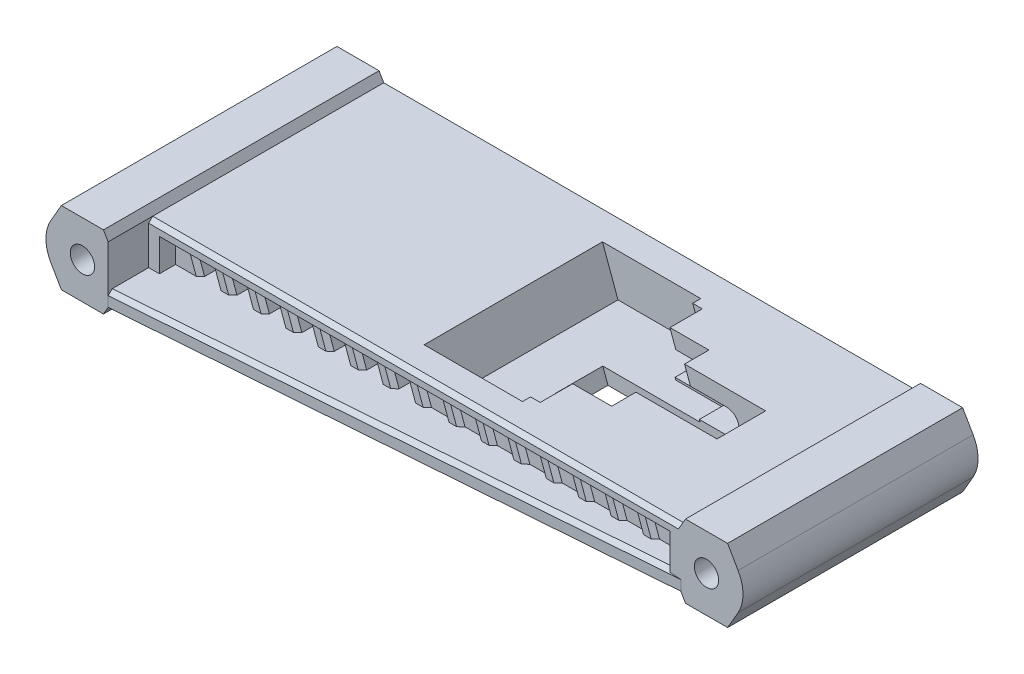
from build123d import *

# Parameters (mm, degrees)
SKETCH2_R           = 1.5
BOSS_EXTRUDE1_DEPTH = 2.5
SKETCH3_R           = 1.5
BOSS_EXTRUDE2_DEPTH = 24
SKETCH6_R           = 1.5
BOSS_EXTRUDE3_DEPTH = 0.5
SKETCH7_R           = 1.5
SKETCH7_W           = 63
SKETCH7_H           = 3.5
BOSS_EXTRUDE4_DEPTH = 7
CUT_EXTRUDE1_DEPTH  = 5
CUT_EXTRUDE2_DEPTH  = 5.25
CHAMFER1_SIZE       = 0.5
CUT_EXTRUDE3_DEPTH  = 3
CUT_EXTRUDE4_DEPTH  = 6
CUT_EXTRUDE5_DEPTH  = 11
CUT_EXTRUDE6_DEPTH  = 10


with BuildPart() as part:
    # Sketch2 → Boss-Extrude1 (new body)
    with BuildSketch(Plane.XY):
        with BuildLine():
            Line((32.824573519, -3.5), (-32.824573519, -3.5))
            Line((-32.824573519, -3.5), (-33.401923789, -4.5))
            Line((-33.401923789, -4.5), (-38.598076211, -4.5))
            Line((-38.598076211, -4.5), (-39.897114317, -2.25))
            ThreePointArc((-39.897114317, -2.25), (-40.5, 0), (-39.897114317, 2.25))
            Line((-39.897114317, 2.25), (-38.598076211, 4.5))
            Line((-38.598076211, 4.5), (-33.401923789, 4.5))
            Line((-33.401923789, 4.5), (-32.824573519, 3.5))
            Line((-32.824573519, 3.5), (32.824573519, 3.5))
            Line((32.824573519, 3.5), (33.401923789, 4.5))
            Line((33.401923789, 4.5), (38.598076211, 4.5))
            Line((38.598076211, 4.5), (39.897114317, 2.25))
            ThreePointArc((39.897114317, 2.25), (40.5, 0), (39.897114317, -2.25))
            Line((39.897114317, -2.25), (38.598076211, -4.5))
            Line((38.598076211, -4.5), (33.401923789, -4.5))
            Line((33.401923789, -4.5), (32.824573519, -3.5))
        make_face()
        with Locations((-36, 0)):
            Circle(SKETCH2_R, mode=Mode.SUBTRACT)
        with Locations((36, 0)):
            Circle(SKETCH2_R, mode=Mode.SUBTRACT)
        Polygon((-27.701125682, 1.75), (-26.427229863, -1.75), (-28.427229863, -1.75), (-29.701125682, 1.75), align=None, mode=Mode.SUBTRACT)
        Polygon((-25.701125682, 1.75), (-24.427229863, -1.75), (-22.427229863, -1.75), (-23.701125682, 1.75), align=None, mode=Mode.SUBTRACT)
        Polygon((-21.701125682, 1.75), (-20.427229863, -1.75), (-18.427229863, -1.75), (-19.701125682, 1.75), align=None, mode=Mode.SUBTRACT)
        Polygon((-17.701125682, 1.75), (-16.427229863, -1.75), (-14.427229863, -1.75), (-15.701125682, 1.75), align=None, mode=Mode.SUBTRACT)
        Polygon((-13.701125682, 1.75), (-12.427229863, -1.75), (-10.427229863, -1.75), (-11.701125682, 1.75), align=None, mode=Mode.SUBTRACT)
        Polygon((-9.701125682, 1.75), (-8.427229863, -1.75), (-6.427229863, -1.75), (-7.701125682, 1.75), align=None, mode=Mode.SUBTRACT)
        Polygon((-5.701125682, 1.75), (-4.427229863, -1.75), (-2.427229863, -1.75), (-3.701125682, 1.75), align=None, mode=Mode.SUBTRACT)
        Polygon((-1.701125682, 1.75), (-0.427229863, -1.75), (1.701125682, -1.75), (0.427229863, 1.75), align=None, mode=Mode.SUBTRACT)
        Polygon((2.427229863, 1.75), (3.701125682, -1.75), (5.701125682, -1.75), (4.427229863, 1.75), align=None, mode=Mode.SUBTRACT)
        Polygon((6.427229863, 1.75), (7.701125682, -1.75), (9.701125682, -1.75), (8.427229863, 1.75), align=None, mode=Mode.SUBTRACT)
        Polygon((10.427229863, 1.75), (11.701125682, -1.75), (13.701125682, -1.75), (12.427229863, 1.75), align=None, mode=Mode.SUBTRACT)
        Polygon((14.427229863, 1.75), (15.701125682, -1.75), (17.701125682, -1.75), (16.427229863, 1.75), align=None, mode=Mode.SUBTRACT)
        Polygon((18.427229863, 1.75), (19.701125682, -1.75), (21.701125682, -1.75), (20.427229863, 1.75), align=None, mode=Mode.SUBTRACT)
        Polygon((22.427229863, 1.75), (23.701125682, -1.75), (25.701125682, -1.75), (24.427229863, 1.75), align=None, mode=Mode.SUBTRACT)
        Polygon((26.427229863, 1.75), (27.701125682, -1.75), (29.701125682, -1.75), (28.427229863, 1.75), align=None, mode=Mode.SUBTRACT)
    extrude(amount=BOSS_EXTRUDE1_DEPTH)

    # Sketch3 → Boss-Extrude2 (add)
    with BuildSketch(Plane.XY.offset(2.5)):
        with BuildLine():
            Line((-39.897114317, -2.25), (-38.598076211, -4.5))
            Line((-38.598076211, -4.5), (-33.401923789, -4.5))
            Line((-33.401923789, -4.5), (-32.824573519, -3.5))
            Line((-32.824573519, -3.5), (32.824573519, -3.5))
            Line((32.824573519, -3.5), (33.401923789, -4.5))
            Line((33.401923789, -4.5), (38.598076211, -4.5))
            Line((38.598076211, -4.5), (39.897114317, -2.25))
            ThreePointArc((39.897114317, -2.25), (40.5, 0), (39.897114317, 2.25))
            Line((39.897114317, 2.25), (38.598076211, 4.5))
            Line((38.598076211, 4.5), (33.401923789, 4.5))
            Line((33.401923789, 4.5), (32.824573519, 3.5))
            Line((32.824573519, 3.5), (-32.824573519, 3.5))
            Line((-32.824573519, 3.5), (-33.401923789, 4.5))
            Line((-33.401923789, 4.5), (-38.598076211, 4.5))
            Line((-38.598076211, 4.5), (-39.897114317, 2.25))
            ThreePointArc((-39.897114317, 2.25), (-40.5, 0), (-39.897114317, -2.25))
        make_face()
        with Locations((-36, 0)):
            Circle(SKETCH3_R, mode=Mode.SUBTRACT)
        with Locations((36, 0)):
            Circle(SKETCH3_R, mode=Mode.SUBTRACT)
        Polygon((-27.701125682, 1.75), (-29.701125682, 1.75), (-28.427229863, -1.75), (-26.427229863, -1.75), align=None, mode=Mode.SUBTRACT)
        Polygon((-25.701125682, 1.75), (-24.427229863, -1.75), (-22.427229863, -1.75), (-23.701125682, 1.75), align=None, mode=Mode.SUBTRACT)
        Polygon((-21.701125682, 1.75), (-20.427229863, -1.75), (-18.427229863, -1.75), (-19.701125682, 1.75), align=None, mode=Mode.SUBTRACT)
        Polygon((-17.701125682, 1.75), (-16.427229863, -1.75), (-14.427229863, -1.75), (-15.701125682, 1.75), align=None, mode=Mode.SUBTRACT)
        Polygon((-13.701125682, 1.75), (-12.427229863, -1.75), (-10.427229863, -1.75), (-11.701125682, 1.75), align=None, mode=Mode.SUBTRACT)
        Polygon((-9.701125682, 1.75), (-8.427229863, -1.75), (-6.427229863, -1.75), (-7.701125682, 1.75), align=None, mode=Mode.SUBTRACT)
        Polygon((-5.701125682, 1.75), (-4.427229863, -1.75), (-2.427229863, -1.75), (-3.701125682, 1.75), align=None, mode=Mode.SUBTRACT)
    extrude(amount=BOSS_EXTRUDE2_DEPTH)

    # Sketch6 → Boss-Extrude3 (add)
    with BuildSketch(Plane.XY.offset(26.5)):
        with BuildLine():
            Line((-38.598076211, 4.5), (-39.897114317, 2.25))
            ThreePointArc((-39.897114317, 2.25), (-40.5, 0), (-39.897114317, -2.25))
            Line((-39.897114317, -2.25), (-38.598076211, -4.5))
            Line((-38.598076211, -4.5), (-33.401923789, -4.5))
            Line((-33.401923789, -4.5), (-32.824573519, -3.5))
            Line((-32.824573519, -3.5), (32.824573519, -3.5))
            Line((32.824573519, -3.5), (33.401923789, -4.5))
            Line((33.401923789, -4.5), (38.598076211, -4.5))
            Line((38.598076211, -4.5), (39.897114317, -2.25))
            ThreePointArc((39.897114317, -2.25), (40.5, 0), (39.897114317, 2.25))
            Line((39.897114317, 2.25), (38.598076211, 4.5))
            Line((38.598076211, 4.5), (33.401923789, 4.5))
            Line((33.401923789, 4.5), (32.824573519, 3.5))
            Line((32.824573519, 3.5), (-32.824573519, 3.5))
            Line((-32.824573519, 3.5), (-33.401923789, 4.5))
            Line((-33.401923789, 4.5), (-38.598076211, 4.5))
        make_face()
        with Locations((-36, 0)):
            Circle(SKETCH6_R, mode=Mode.SUBTRACT)
        with Locations((36, 0)):
            Circle(SKETCH6_R, mode=Mode.SUBTRACT)
        Polygon((-28.427229863, -1.75), (-26.427229863, -1.75), (-27.701125682, 1.75), (-29.701125682, 1.75), align=None, mode=Mode.SUBTRACT)
        Polygon((28.427229863, 1.75), (26.427229863, 1.75), (27.701125682, -1.75), (29.701125682, -1.75), align=None, mode=Mode.SUBTRACT)
        Polygon((-25.701125682, 1.75), (-24.427229863, -1.75), (-22.427229863, -1.75), (-23.701125682, 1.75), align=None, mode=Mode.SUBTRACT)
        Polygon((-21.701125682, 1.75), (-20.427229863, -1.75), (-18.427229863, -1.75), (-19.701125682, 1.75), align=None, mode=Mode.SUBTRACT)
        Polygon((-17.701125682, 1.75), (-16.427229863, -1.75), (-14.427229863, -1.75), (-15.701125682, 1.75), align=None, mode=Mode.SUBTRACT)
        Polygon((-13.701125682, 1.75), (-12.427229863, -1.75), (-10.427229863, -1.75), (-11.701125682, 1.75), align=None, mode=Mode.SUBTRACT)
        Polygon((-9.701125682, 1.75), (-8.427229863, -1.75), (-6.427229863, -1.75), (-7.701125682, 1.75), align=None, mode=Mode.SUBTRACT)
        Polygon((-5.701125682, 1.75), (-4.427229863, -1.75), (-2.427229863, -1.75), (-3.701125682, 1.75), align=None, mode=Mode.SUBTRACT)
        Polygon((-1.701125682, 1.75), (-0.427229863, -1.75), (1.701125682, -1.75), (0.427229863, 1.75), align=None, mode=Mode.SUBTRACT)
        Polygon((2.427229863, 1.75), (3.701125682, -1.75), (5.701125682, -1.75), (4.427229863, 1.75), align=None, mode=Mode.SUBTRACT)
        Polygon((6.427229863, 1.75), (7.701125682, -1.75), (9.701125682, -1.75), (8.427229863, 1.75), align=None, mode=Mode.SUBTRACT)
        Polygon((10.427229863, 1.75), (11.701125682, -1.75), (13.701125682, -1.75), (12.427229863, 1.75), align=None, mode=Mode.SUBTRACT)
        Polygon((14.427229863, 1.75), (15.701125682, -1.75), (17.701125682, -1.75), (16.427229863, 1.75), align=None, mode=Mode.SUBTRACT)
        Polygon((18.427229863, 1.75), (19.701125682, -1.75), (21.701125682, -1.75), (20.427229863, 1.75), align=None, mode=Mode.SUBTRACT)
        Polygon((22.427229863, 1.75), (23.701125682, -1.75), (25.701125682, -1.75), (24.427229863, 1.75), align=None, mode=Mode.SUBTRACT)
    extrude(amount=BOSS_EXTRUDE3_DEPTH)

    # Sketch7 → Boss-Extrude4 (add)
    with BuildSketch(Plane.XY.offset(27)):
        with BuildLine():
            Line((-33.401923789, 4.5), (-38.598076211, 4.5))
            Line((-38.598076211, 4.5), (-39.897114317, 2.25))
            ThreePointArc((-39.897114317, 2.25), (-40.5, 0), (-39.897114317, -2.25))
            Line((-39.897114317, -2.25), (-38.598076211, -4.5))
            Line((-38.598076211, -4.5), (-33.401923789, -4.5))
            Line((-33.401923789, -4.5), (-32.824573519, -3.5))
            Line((-32.824573519, -3.5), (32.824573519, -3.5))
            Line((32.824573519, -3.5), (33.401923789, -4.5))
            Line((33.401923789, -4.5), (38.598076211, -4.5))
            Line((38.598076211, -4.5), (39.897114317, -2.25))
            ThreePointArc((39.897114317, -2.25), (40.5, 0), (39.897114317, 2.25))
            Line((39.897114317, 2.25), (38.598076211, 4.5))
            Line((38.598076211, 4.5), (33.401923789, 4.5))
            Line((33.401923789, 4.5), (32.824573519, 3.5))
            Line((32.824573519, 3.5), (-32.824573519, 3.5))
            Line((-32.824573519, 3.5), (-33.401923789, 4.5))
        make_face()
        with Locations((-36, 0)):
            Circle(SKETCH7_R, mode=Mode.SUBTRACT)
        with Locations((36, 0)):
            Circle(SKETCH7_R, mode=Mode.SUBTRACT)
        Rectangle(SKETCH7_W, SKETCH7_H, mode=Mode.SUBTRACT)
    extrude(amount=BOSS_EXTRUDE4_DEPTH)

    # Sketch8 → Cut-Extrude1 (cut, symmetric)
    with BuildSketch(Plane(origin=(0, 0, 0), x_dir=(1, 0, 0), z_dir=(0, 1, 0))):
        Polygon((40.5, -34), (-32.824573519, -34), (32.824573519, -29), (40.5, -29), align=None)
    extrude(amount=CUT_EXTRUDE1_DEPTH, both=True, mode=Mode.SUBTRACT)

    # Sketch9 → Cut-Extrude2 (cut)
    with BuildSketch(Plane(origin=(0, 3.5, 0), x_dir=(1, 0, 0), z_dir=(0, 1, 0))):
        Polygon((32.824573519, -29), (-32.824573519, -29), (-32.824573519, -34), align=None)
    extrude(amount=-CUT_EXTRUDE2_DEPTH, mode=Mode.SUBTRACT)

    # Chamfer1
    # the kernel refuses this chamfer: 0.5 mm, written as the material it takes off along each edge
    with BuildSketch(Plane(origin=(18.140909375, -2.958295763, 27), x_dir=(0.9393373388974084, 0.3418908312934854, 0.0274958766105891), z_dir=(-0.34202014332567277, 0.939692620785907, 0))) as chamfer1_piece_1_section:
        Polygon((CHAMFER1_SIZE * 0.999621916911, CHAMFER1_SIZE * 0.0274958766106), (-CHAMFER1_SIZE * 0.0274958766106, CHAMFER1_SIZE * 0.999621916911), (0, 0), align=None)
    chamfer1_piece_1 = extrude(amount=6.296305192, mode=Mode.PRIVATE)
    chamfer1_piece_1 = split(chamfer1_piece_1, bisect_by=Plane(origin=(17.239982151, -1.75, 26.835682833), z_dir=(0, 1, 0)), keep=Keep.TOP, mode=Mode.PRIVATE)
    chamfer1_piece_1 = split(chamfer1_piece_1, bisect_by=Plane(origin=(17.239982151, 1.75, 26.835682833), z_dir=(0, -1, 0)), keep=Keep.TOP, mode=Mode.PRIVATE)
    chamfer1_piece_1 = split(chamfer1_piece_1, bisect_by=Plane(origin=(17.239982151, 0, 26.5), z_dir=(0, 0, 1)), keep=Keep.TOP, mode=Mode.PRIVATE)
    add(chamfer1_piece_1, mode=Mode.SUBTRACT)
    with BuildSketch(Plane(origin=(17.98744617, 2.958295763, 27), x_dir=(0.025837672353008382, 0.009404143659217963, -0.9996219169112968), z_dir=(0.34202014332567277, -0.939692620785907, 0))) as chamfer1_piece_2_section:
        Polygon((CHAMFER1_SIZE * 0.999621916911, -CHAMFER1_SIZE * 0.0274958766106), (-CHAMFER1_SIZE * 0.0274958766106, -CHAMFER1_SIZE * 0.999621916911), (0, 0), align=None)
    chamfer1_piece_2 = extrude(amount=6.296305192, mode=Mode.PRIVATE)
    chamfer1_piece_2 = split(chamfer1_piece_2, bisect_by=Plane(origin=(18.888373394, -1.75, 26.835682833), z_dir=(0, 1, 0)), keep=Keep.TOP, mode=Mode.PRIVATE)
    chamfer1_piece_2 = split(chamfer1_piece_2, bisect_by=Plane(origin=(18.888373394, 1.75, 26.835682833), z_dir=(0, -1, 0)), keep=Keep.TOP, mode=Mode.PRIVATE)
    chamfer1_piece_2 = split(chamfer1_piece_2, bisect_by=Plane(origin=(18.888373394, 0, 26.5), z_dir=(0, 0, 1)), keep=Keep.TOP, mode=Mode.PRIVATE)
    add(chamfer1_piece_2, mode=Mode.SUBTRACT)
    with BuildSketch(Plane(origin=(22.140909375, -2.958295763, 27), x_dir=(0.9393373388974084, 0.3418908312934854, 0.0274958766105891), z_dir=(-0.34202014332567277, 0.939692620785907, 0))) as chamfer1_piece_3_section:
        Polygon((CHAMFER1_SIZE * 0.999621916911, CHAMFER1_SIZE * 0.0274958766106), (-CHAMFER1_SIZE * 0.0274958766106, CHAMFER1_SIZE * 0.999621916911), (0, 0), align=None)
    chamfer1_piece_3 = extrude(amount=6.296305192, mode=Mode.PRIVATE)
    chamfer1_piece_3 = split(chamfer1_piece_3, bisect_by=Plane(origin=(21.239982151, -1.75, 26.835682833), z_dir=(0, 1, 0)), keep=Keep.TOP, mode=Mode.PRIVATE)
    chamfer1_piece_3 = split(chamfer1_piece_3, bisect_by=Plane(origin=(21.239982151, 1.75, 26.835682833), z_dir=(0, -1, 0)), keep=Keep.TOP, mode=Mode.PRIVATE)
    chamfer1_piece_3 = split(chamfer1_piece_3, bisect_by=Plane(origin=(21.239982151, 0, 26.5), z_dir=(0, 0, 1)), keep=Keep.TOP, mode=Mode.PRIVATE)
    add(chamfer1_piece_3, mode=Mode.SUBTRACT)
    with BuildSketch(Plane(origin=(21.98744617, 2.958295763, 27), x_dir=(0.025837672353009215, 0.009404143659218267, -0.9996219169112968), z_dir=(0.34202014332567277, -0.939692620785907, 0))) as chamfer1_piece_4_section:
        Polygon((CHAMFER1_SIZE * 0.999621916911, -CHAMFER1_SIZE * 0.0274958766106), (-CHAMFER1_SIZE * 0.0274958766106, -CHAMFER1_SIZE * 0.999621916911), (0, 0), align=None)
    chamfer1_piece_4 = extrude(amount=6.296305192, mode=Mode.PRIVATE)
    chamfer1_piece_4 = split(chamfer1_piece_4, bisect_by=Plane(origin=(22.888373394, -1.75, 26.835682833), z_dir=(0, 1, 0)), keep=Keep.TOP, mode=Mode.PRIVATE)
    chamfer1_piece_4 = split(chamfer1_piece_4, bisect_by=Plane(origin=(22.888373394, 1.75, 26.835682833), z_dir=(0, -1, 0)), keep=Keep.TOP, mode=Mode.PRIVATE)
    chamfer1_piece_4 = split(chamfer1_piece_4, bisect_by=Plane(origin=(22.888373394, 0, 26.5), z_dir=(0, 0, 1)), keep=Keep.TOP, mode=Mode.PRIVATE)
    add(chamfer1_piece_4, mode=Mode.SUBTRACT)
    with BuildSketch(Plane(origin=(26.140909375, -2.958295763, 27), x_dir=(0.9393373388974084, 0.3418908312934854, 0.0274958766105891), z_dir=(-0.34202014332567277, 0.939692620785907, 0))) as chamfer1_piece_5_section:
        Polygon((CHAMFER1_SIZE * 0.999621916911, CHAMFER1_SIZE * 0.0274958766106), (-CHAMFER1_SIZE * 0.0274958766106, CHAMFER1_SIZE * 0.999621916911), (0, 0), align=None)
    chamfer1_piece_5 = extrude(amount=6.296305192, mode=Mode.PRIVATE)
    chamfer1_piece_5 = split(chamfer1_piece_5, bisect_by=Plane(origin=(25.239982151, -1.75, 26.835682833), z_dir=(0, 1, 0)), keep=Keep.TOP, mode=Mode.PRIVATE)
    chamfer1_piece_5 = split(chamfer1_piece_5, bisect_by=Plane(origin=(25.239982151, 1.75, 26.835682833), z_dir=(0, -1, 0)), keep=Keep.TOP, mode=Mode.PRIVATE)
    chamfer1_piece_5 = split(chamfer1_piece_5, bisect_by=Plane(origin=(25.239982151, 0, 26.5), z_dir=(0, 0, 1)), keep=Keep.TOP, mode=Mode.PRIVATE)
    add(chamfer1_piece_5, mode=Mode.SUBTRACT)
    with BuildSketch(Plane(origin=(25.98744617, 2.958295763, 27), x_dir=(0.025837672353009766, 0.00940414365921847, -0.9996219169112968), z_dir=(0.34202014332567277, -0.939692620785907, 0))) as chamfer1_piece_6_section:
        Polygon((CHAMFER1_SIZE * 0.999621916911, -CHAMFER1_SIZE * 0.0274958766106), (-CHAMFER1_SIZE * 0.0274958766106, -CHAMFER1_SIZE * 0.999621916911), (0, 0), align=None)
    chamfer1_piece_6 = extrude(amount=6.296305192, mode=Mode.PRIVATE)
    chamfer1_piece_6 = split(chamfer1_piece_6, bisect_by=Plane(origin=(26.888373394, -1.75, 26.835682833), z_dir=(0, 1, 0)), keep=Keep.TOP, mode=Mode.PRIVATE)
    chamfer1_piece_6 = split(chamfer1_piece_6, bisect_by=Plane(origin=(26.888373394, 1.75, 26.835682833), z_dir=(0, -1, 0)), keep=Keep.TOP, mode=Mode.PRIVATE)
    chamfer1_piece_6 = split(chamfer1_piece_6, bisect_by=Plane(origin=(26.888373394, 0, 26.5), z_dir=(0, 0, 1)), keep=Keep.TOP, mode=Mode.PRIVATE)
    add(chamfer1_piece_6, mode=Mode.SUBTRACT)
    with BuildSketch(Plane(origin=(30.140909375, -2.958295763, 27), x_dir=(0.9393373388974084, 0.3418908312934854, 0.0274958766105891), z_dir=(-0.34202014332567277, 0.939692620785907, 0))) as chamfer1_piece_7_section:
        Polygon((CHAMFER1_SIZE * 0.999621916911, CHAMFER1_SIZE * 0.0274958766106), (-CHAMFER1_SIZE * 0.0274958766106, CHAMFER1_SIZE * 0.999621916911), (0, 0), align=None)
    chamfer1_piece_7 = extrude(amount=6.296305192, mode=Mode.PRIVATE)
    chamfer1_piece_7 = split(chamfer1_piece_7, bisect_by=Plane(origin=(29.239982151, -1.75, 26.835682833), z_dir=(0, 1, 0)), keep=Keep.TOP, mode=Mode.PRIVATE)
    chamfer1_piece_7 = split(chamfer1_piece_7, bisect_by=Plane(origin=(29.239982151, 1.75, 26.835682833), z_dir=(0, -1, 0)), keep=Keep.TOP, mode=Mode.PRIVATE)
    chamfer1_piece_7 = split(chamfer1_piece_7, bisect_by=Plane(origin=(29.239982151, 0, 26.5), z_dir=(0, 0, 1)), keep=Keep.TOP, mode=Mode.PRIVATE)
    add(chamfer1_piece_7, mode=Mode.SUBTRACT)
    with BuildSketch(Plane(origin=(13.98744617, 2.958295763, 27), x_dir=(0.025837672353008937, 0.009404143659218166, -0.9996219169112968), z_dir=(0.34202014332567277, -0.939692620785907, 0))) as chamfer1_piece_8_section:
        Polygon((CHAMFER1_SIZE * 0.999621916911, -CHAMFER1_SIZE * 0.0274958766106), (-CHAMFER1_SIZE * 0.0274958766106, -CHAMFER1_SIZE * 0.999621916911), (0, 0), align=None)
    chamfer1_piece_8 = extrude(amount=6.296305192, mode=Mode.PRIVATE)
    chamfer1_piece_8 = split(chamfer1_piece_8, bisect_by=Plane(origin=(14.888373394, -1.75, 26.835682833), z_dir=(0, 1, 0)), keep=Keep.TOP, mode=Mode.PRIVATE)
    chamfer1_piece_8 = split(chamfer1_piece_8, bisect_by=Plane(origin=(14.888373394, 1.75, 26.835682833), z_dir=(0, -1, 0)), keep=Keep.TOP, mode=Mode.PRIVATE)
    chamfer1_piece_8 = split(chamfer1_piece_8, bisect_by=Plane(origin=(14.888373394, 0, 26.5), z_dir=(0, 0, 1)), keep=Keep.TOP, mode=Mode.PRIVATE)
    add(chamfer1_piece_8, mode=Mode.SUBTRACT)
    with BuildSketch(Plane(origin=(14.140909375, -2.958295763, 27), x_dir=(0.9393373388974083, 0.34189083129348585, 0.0274958766105891), z_dir=(-0.34202014332567315, 0.9396926207859068, 0))) as chamfer1_piece_9_section:
        Polygon((CHAMFER1_SIZE * 0.999621916911, CHAMFER1_SIZE * 0.0274958766106), (-CHAMFER1_SIZE * 0.0274958766106, CHAMFER1_SIZE * 0.999621916911), (0, 0), align=None)
    chamfer1_piece_9 = extrude(amount=6.296305192, mode=Mode.PRIVATE)
    chamfer1_piece_9 = split(chamfer1_piece_9, bisect_by=Plane(origin=(13.239982151, -1.75, 26.835682833), z_dir=(0, 1, 0)), keep=Keep.TOP, mode=Mode.PRIVATE)
    chamfer1_piece_9 = split(chamfer1_piece_9, bisect_by=Plane(origin=(13.239982151, 1.75, 26.835682833), z_dir=(0, -1, 0)), keep=Keep.TOP, mode=Mode.PRIVATE)
    chamfer1_piece_9 = split(chamfer1_piece_9, bisect_by=Plane(origin=(13.239982151, 0, 26.5), z_dir=(0, 0, 1)), keep=Keep.TOP, mode=Mode.PRIVATE)
    add(chamfer1_piece_9, mode=Mode.SUBTRACT)
    with BuildSketch(Plane(origin=(9.98744617, 2.958295763, 27), x_dir=(0.025837672353008382, 0.009404143659217963, -0.9996219169112968), z_dir=(0.34202014332567277, -0.939692620785907, 0))) as chamfer1_piece_10_section:
        Polygon((CHAMFER1_SIZE * 0.999621916911, -CHAMFER1_SIZE * 0.0274958766106), (-CHAMFER1_SIZE * 0.0274958766106, -CHAMFER1_SIZE * 0.999621916911), (0, 0), align=None)
    chamfer1_piece_10 = extrude(amount=6.296305192, mode=Mode.PRIVATE)
    chamfer1_piece_10 = split(chamfer1_piece_10, bisect_by=Plane(origin=(10.888373394, -1.75, 26.835682833), z_dir=(0, 1, 0)), keep=Keep.TOP, mode=Mode.PRIVATE)
    chamfer1_piece_10 = split(chamfer1_piece_10, bisect_by=Plane(origin=(10.888373394, 1.75, 26.835682833), z_dir=(0, -1, 0)), keep=Keep.TOP, mode=Mode.PRIVATE)
    chamfer1_piece_10 = split(chamfer1_piece_10, bisect_by=Plane(origin=(10.888373394, 0, 26.5), z_dir=(0, 0, 1)), keep=Keep.TOP, mode=Mode.PRIVATE)
    add(chamfer1_piece_10, mode=Mode.SUBTRACT)
    with BuildSketch(Plane(origin=(10.140909375, -2.958295763, 27), x_dir=(0.9393373388974083, 0.34189083129348585, 0.0274958766105891), z_dir=(-0.34202014332567315, 0.9396926207859068, 0))) as chamfer1_piece_11_section:
        Polygon((CHAMFER1_SIZE * 0.999621916911, CHAMFER1_SIZE * 0.0274958766106), (-CHAMFER1_SIZE * 0.0274958766106, CHAMFER1_SIZE * 0.999621916911), (0, 0), align=None)
    chamfer1_piece_11 = extrude(amount=6.296305192, mode=Mode.PRIVATE)
    chamfer1_piece_11 = split(chamfer1_piece_11, bisect_by=Plane(origin=(9.239982151, -1.75, 26.835682833), z_dir=(0, 1, 0)), keep=Keep.TOP, mode=Mode.PRIVATE)
    chamfer1_piece_11 = split(chamfer1_piece_11, bisect_by=Plane(origin=(9.239982151, 1.75, 26.835682833), z_dir=(0, -1, 0)), keep=Keep.TOP, mode=Mode.PRIVATE)
    chamfer1_piece_11 = split(chamfer1_piece_11, bisect_by=Plane(origin=(9.239982151, 0, 26.5), z_dir=(0, 0, 1)), keep=Keep.TOP, mode=Mode.PRIVATE)
    add(chamfer1_piece_11, mode=Mode.SUBTRACT)
    with BuildSketch(Plane(origin=(5.98744617, 2.958295763, 27), x_dir=(0.025837672353008382, 0.009404143659217963, -0.9996219169112968), z_dir=(0.34202014332567277, -0.939692620785907, 0))) as chamfer1_piece_12_section:
        Polygon((CHAMFER1_SIZE * 0.999621916911, -CHAMFER1_SIZE * 0.0274958766106), (-CHAMFER1_SIZE * 0.0274958766106, -CHAMFER1_SIZE * 0.999621916911), (0, 0), align=None)
    chamfer1_piece_12 = extrude(amount=6.296305192, mode=Mode.PRIVATE)
    chamfer1_piece_12 = split(chamfer1_piece_12, bisect_by=Plane(origin=(6.888373394, -1.75, 26.835682833), z_dir=(0, 1, 0)), keep=Keep.TOP, mode=Mode.PRIVATE)
    chamfer1_piece_12 = split(chamfer1_piece_12, bisect_by=Plane(origin=(6.888373394, 1.75, 26.835682833), z_dir=(0, -1, 0)), keep=Keep.TOP, mode=Mode.PRIVATE)
    chamfer1_piece_12 = split(chamfer1_piece_12, bisect_by=Plane(origin=(6.888373394, 0, 26.5), z_dir=(0, 0, 1)), keep=Keep.TOP, mode=Mode.PRIVATE)
    add(chamfer1_piece_12, mode=Mode.SUBTRACT)
    with BuildSketch(Plane(origin=(6.140909375, -2.958295763, 27), x_dir=(0.9393373388974086, 0.3418908312934855, 0.027495876610589057), z_dir=(-0.34202014332567277, 0.939692620785907, 0))) as chamfer1_piece_13_section:
        Polygon((CHAMFER1_SIZE * 0.999621916911, CHAMFER1_SIZE * 0.0274958766106), (-CHAMFER1_SIZE * 0.0274958766106, CHAMFER1_SIZE * 0.999621916911), (0, 0), align=None)
    chamfer1_piece_13 = extrude(amount=6.296305192, mode=Mode.PRIVATE)
    chamfer1_piece_13 = split(chamfer1_piece_13, bisect_by=Plane(origin=(5.239982151, -1.75, 26.835682833), z_dir=(0, 1, 0)), keep=Keep.TOP, mode=Mode.PRIVATE)
    chamfer1_piece_13 = split(chamfer1_piece_13, bisect_by=Plane(origin=(5.239982151, 1.75, 26.835682833), z_dir=(0, -1, 0)), keep=Keep.TOP, mode=Mode.PRIVATE)
    chamfer1_piece_13 = split(chamfer1_piece_13, bisect_by=Plane(origin=(5.239982151, 0, 26.5), z_dir=(0, 0, 1)), keep=Keep.TOP, mode=Mode.PRIVATE)
    add(chamfer1_piece_13, mode=Mode.SUBTRACT)
    with BuildSketch(Plane(origin=(1.98744617, 2.958295763, 27), x_dir=(0.025837672353007896, 0.009404143659217788, -0.9996219169112968), z_dir=(0.34202014332567277, -0.939692620785907, 0))) as chamfer1_piece_14_section:
        Polygon((CHAMFER1_SIZE * 0.999621916911, -CHAMFER1_SIZE * 0.0274958766106), (-CHAMFER1_SIZE * 0.0274958766106, -CHAMFER1_SIZE * 0.999621916911), (0, 0), align=None)
    chamfer1_piece_14 = extrude(amount=6.296305192, mode=Mode.PRIVATE)
    chamfer1_piece_14 = split(chamfer1_piece_14, bisect_by=Plane(origin=(2.888373394, -1.75, 26.835682833), z_dir=(0, 1, 0)), keep=Keep.TOP, mode=Mode.PRIVATE)
    chamfer1_piece_14 = split(chamfer1_piece_14, bisect_by=Plane(origin=(2.888373394, 1.75, 26.835682833), z_dir=(0, -1, 0)), keep=Keep.TOP, mode=Mode.PRIVATE)
    chamfer1_piece_14 = split(chamfer1_piece_14, bisect_by=Plane(origin=(2.888373394, 0, 26.5), z_dir=(0, 0, 1)), keep=Keep.TOP, mode=Mode.PRIVATE)
    add(chamfer1_piece_14, mode=Mode.SUBTRACT)
    with BuildSketch(Plane(origin=(2.140909375, -2.958295763, 27), x_dir=(0.9393373388974084, 0.34189083129348546, 0.027495876610589075), z_dir=(-0.3420201433256728, 0.939692620785907, 0))) as chamfer1_piece_15_section:
        Polygon((CHAMFER1_SIZE * 0.999621916911, CHAMFER1_SIZE * 0.0274958766106), (-CHAMFER1_SIZE * 0.0274958766106, CHAMFER1_SIZE * 0.999621916911), (0, 0), align=None)
    chamfer1_piece_15 = extrude(amount=6.296305192, mode=Mode.PRIVATE)
    chamfer1_piece_15 = split(chamfer1_piece_15, bisect_by=Plane(origin=(1.239982151, -1.75, 26.835682833), z_dir=(0, 1, 0)), keep=Keep.TOP, mode=Mode.PRIVATE)
    chamfer1_piece_15 = split(chamfer1_piece_15, bisect_by=Plane(origin=(1.239982151, 1.75, 26.835682833), z_dir=(0, -1, 0)), keep=Keep.TOP, mode=Mode.PRIVATE)
    chamfer1_piece_15 = split(chamfer1_piece_15, bisect_by=Plane(origin=(1.239982151, 0, 26.5), z_dir=(0, 0, 1)), keep=Keep.TOP, mode=Mode.PRIVATE)
    add(chamfer1_piece_15, mode=Mode.SUBTRACT)
    with BuildSketch(Plane(origin=(-2.140909375, 2.958295763, 27), x_dir=(0.025837672353007896, 0.00940414365921779, -0.9996219169112968), z_dir=(0.3420201433256728, -0.939692620785907, 0))) as chamfer1_piece_16_section:
        Polygon((CHAMFER1_SIZE * 0.999621916911, -CHAMFER1_SIZE * 0.0274958766106), (-CHAMFER1_SIZE * 0.0274958766106, -CHAMFER1_SIZE * 0.999621916911), (0, 0), align=None)
    chamfer1_piece_16 = extrude(amount=6.296305192, mode=Mode.PRIVATE)
    chamfer1_piece_16 = split(chamfer1_piece_16, bisect_by=Plane(origin=(-1.239982151, -1.75, 26.835682833), z_dir=(0, 1, 0)), keep=Keep.TOP, mode=Mode.PRIVATE)
    chamfer1_piece_16 = split(chamfer1_piece_16, bisect_by=Plane(origin=(-1.239982151, 1.75, 26.835682833), z_dir=(0, -1, 0)), keep=Keep.TOP, mode=Mode.PRIVATE)
    chamfer1_piece_16 = split(chamfer1_piece_16, bisect_by=Plane(origin=(-1.239982151, 0, 26.5), z_dir=(0, 0, 1)), keep=Keep.TOP, mode=Mode.PRIVATE)
    add(chamfer1_piece_16, mode=Mode.SUBTRACT)
    with BuildSketch(Plane(origin=(-1.98744617, -2.958295763, 27), x_dir=(0.9393373388974084, 0.34189083129348546, 0.027495876610589075), z_dir=(-0.3420201433256728, 0.939692620785907, 0))) as chamfer1_piece_17_section:
        Polygon((CHAMFER1_SIZE * 0.999621916911, CHAMFER1_SIZE * 0.0274958766106), (-CHAMFER1_SIZE * 0.0274958766106, CHAMFER1_SIZE * 0.999621916911), (0, 0), align=None)
    chamfer1_piece_17 = extrude(amount=6.296305192, mode=Mode.PRIVATE)
    chamfer1_piece_17 = split(chamfer1_piece_17, bisect_by=Plane(origin=(-2.888698249, -1.75, 26.835103187), z_dir=(0, 1, 0)), keep=Keep.TOP, mode=Mode.PRIVATE)
    chamfer1_piece_17 = split(chamfer1_piece_17, bisect_by=Plane(origin=(-2.888698249, 1.75, 26.835103187), z_dir=(0, -1, 0)), keep=Keep.TOP, mode=Mode.PRIVATE)
    add(chamfer1_piece_17, mode=Mode.SUBTRACT)
    with BuildSketch(Plane(origin=(-6.140909375, 2.958295763, 27), x_dir=(0.025837672353008382, 0.009404143659217965, -0.9996219169112968), z_dir=(0.3420201433256728, -0.939692620785907, 0))) as chamfer1_piece_18_section:
        Polygon((CHAMFER1_SIZE * 0.999621916911, -CHAMFER1_SIZE * 0.0274958766106), (-CHAMFER1_SIZE * 0.0274958766106, -CHAMFER1_SIZE * 0.999621916911), (0, 0), align=None)
    chamfer1_piece_18 = extrude(amount=6.296305192, mode=Mode.PRIVATE)
    chamfer1_piece_18 = split(chamfer1_piece_18, bisect_by=Plane(origin=(-5.239657296, -1.75, 26.835103187), z_dir=(0, 1, 0)), keep=Keep.TOP, mode=Mode.PRIVATE)
    chamfer1_piece_18 = split(chamfer1_piece_18, bisect_by=Plane(origin=(-5.239657296, 1.75, 26.835103187), z_dir=(0, -1, 0)), keep=Keep.TOP, mode=Mode.PRIVATE)
    add(chamfer1_piece_18, mode=Mode.SUBTRACT)
    with BuildSketch(Plane(origin=(-5.98744617, -2.958295763, 27), x_dir=(0.9393373388974083, 0.34189083129348546, 0.027495876610589054), z_dir=(-0.3420201433256728, 0.939692620785907, 0))) as chamfer1_piece_19_section:
        Polygon((CHAMFER1_SIZE * 0.999621916911, CHAMFER1_SIZE * 0.0274958766106), (-CHAMFER1_SIZE * 0.0274958766106, CHAMFER1_SIZE * 0.999621916911), (0, 0), align=None)
    chamfer1_piece_19 = extrude(amount=6.296305192, mode=Mode.PRIVATE)
    chamfer1_piece_19 = split(chamfer1_piece_19, bisect_by=Plane(origin=(-6.888698249, -1.75, 26.835103187), z_dir=(0, 1, 0)), keep=Keep.TOP, mode=Mode.PRIVATE)
    chamfer1_piece_19 = split(chamfer1_piece_19, bisect_by=Plane(origin=(-6.888698249, 1.75, 26.835103187), z_dir=(0, -1, 0)), keep=Keep.TOP, mode=Mode.PRIVATE)
    add(chamfer1_piece_19, mode=Mode.SUBTRACT)
    with BuildSketch(Plane(origin=(-10.140909375, 2.958295763, 27), x_dir=(0.025837672353008382, 0.009404143659217965, -0.9996219169112968), z_dir=(0.3420201433256728, -0.939692620785907, 0))) as chamfer1_piece_20_section:
        Polygon((CHAMFER1_SIZE * 0.999621916911, -CHAMFER1_SIZE * 0.0274958766106), (-CHAMFER1_SIZE * 0.0274958766106, -CHAMFER1_SIZE * 0.999621916911), (0, 0), align=None)
    chamfer1_piece_20 = extrude(amount=6.296305192, mode=Mode.PRIVATE)
    chamfer1_piece_20 = split(chamfer1_piece_20, bisect_by=Plane(origin=(-9.239657296, -1.75, 26.835103187), z_dir=(0, 1, 0)), keep=Keep.TOP, mode=Mode.PRIVATE)
    chamfer1_piece_20 = split(chamfer1_piece_20, bisect_by=Plane(origin=(-9.239657296, 1.75, 26.835103187), z_dir=(0, -1, 0)), keep=Keep.TOP, mode=Mode.PRIVATE)
    add(chamfer1_piece_20, mode=Mode.SUBTRACT)
    with BuildSketch(Plane(origin=(-9.98744617, -2.958295763, 27), x_dir=(0.9393373388974084, 0.34189083129348546, 0.0274958766105891), z_dir=(-0.3420201433256728, 0.939692620785907, 0))) as chamfer1_piece_21_section:
        Polygon((CHAMFER1_SIZE * 0.999621916911, CHAMFER1_SIZE * 0.0274958766106), (-CHAMFER1_SIZE * 0.0274958766106, CHAMFER1_SIZE * 0.999621916911), (0, 0), align=None)
    chamfer1_piece_21 = extrude(amount=6.296305192, mode=Mode.PRIVATE)
    chamfer1_piece_21 = split(chamfer1_piece_21, bisect_by=Plane(origin=(-10.888698249, -1.75, 26.835103187), z_dir=(0, 1, 0)), keep=Keep.TOP, mode=Mode.PRIVATE)
    chamfer1_piece_21 = split(chamfer1_piece_21, bisect_by=Plane(origin=(-10.888698249, 1.75, 26.835103187), z_dir=(0, -1, 0)), keep=Keep.TOP, mode=Mode.PRIVATE)
    add(chamfer1_piece_21, mode=Mode.SUBTRACT)
    with BuildSketch(Plane(origin=(-14.140909375, 2.958295763, 27), x_dir=(0.025837672353008382, 0.009404143659217965, -0.9996219169112968), z_dir=(0.3420201433256728, -0.939692620785907, 0))) as chamfer1_piece_22_section:
        Polygon((CHAMFER1_SIZE * 0.999621916911, -CHAMFER1_SIZE * 0.0274958766106), (-CHAMFER1_SIZE * 0.0274958766106, -CHAMFER1_SIZE * 0.999621916911), (0, 0), align=None)
    chamfer1_piece_22 = extrude(amount=6.296305192, mode=Mode.PRIVATE)
    chamfer1_piece_22 = split(chamfer1_piece_22, bisect_by=Plane(origin=(-13.239657296, -1.75, 26.835103187), z_dir=(0, 1, 0)), keep=Keep.TOP, mode=Mode.PRIVATE)
    chamfer1_piece_22 = split(chamfer1_piece_22, bisect_by=Plane(origin=(-13.239657296, 1.75, 26.835103187), z_dir=(0, -1, 0)), keep=Keep.TOP, mode=Mode.PRIVATE)
    add(chamfer1_piece_22, mode=Mode.SUBTRACT)
    with BuildSketch(Plane(origin=(-13.98744617, -2.958295763, 27), x_dir=(0.9393373388974082, 0.34189083129348585, 0.027495876610589096), z_dir=(-0.3420201433256732, 0.9396926207859068, 0))) as chamfer1_piece_23_section:
        Polygon((CHAMFER1_SIZE * 0.999621916911, CHAMFER1_SIZE * 0.0274958766106), (-CHAMFER1_SIZE * 0.0274958766106, CHAMFER1_SIZE * 0.999621916911), (0, 0), align=None)
    chamfer1_piece_23 = extrude(amount=6.296305192, mode=Mode.PRIVATE)
    chamfer1_piece_23 = split(chamfer1_piece_23, bisect_by=Plane(origin=(-14.888698249, -1.75, 26.835103187), z_dir=(0, 1, 0)), keep=Keep.TOP, mode=Mode.PRIVATE)
    chamfer1_piece_23 = split(chamfer1_piece_23, bisect_by=Plane(origin=(-14.888698249, 1.75, 26.835103187), z_dir=(0, -1, 0)), keep=Keep.TOP, mode=Mode.PRIVATE)
    add(chamfer1_piece_23, mode=Mode.SUBTRACT)
    with BuildSketch(Plane(origin=(-18.140909375, 2.958295763, 27), x_dir=(0.025837672353008934, 0.009404143659218168, -0.9996219169112968), z_dir=(0.3420201433256728, -0.939692620785907, 0))) as chamfer1_piece_24_section:
        Polygon((CHAMFER1_SIZE * 0.999621916911, -CHAMFER1_SIZE * 0.0274958766106), (-CHAMFER1_SIZE * 0.0274958766106, -CHAMFER1_SIZE * 0.999621916911), (0, 0), align=None)
    chamfer1_piece_24 = extrude(amount=6.296305192, mode=Mode.PRIVATE)
    chamfer1_piece_24 = split(chamfer1_piece_24, bisect_by=Plane(origin=(-17.239657296, -1.75, 26.835103187), z_dir=(0, 1, 0)), keep=Keep.TOP, mode=Mode.PRIVATE)
    chamfer1_piece_24 = split(chamfer1_piece_24, bisect_by=Plane(origin=(-17.239657296, 1.75, 26.835103187), z_dir=(0, -1, 0)), keep=Keep.TOP, mode=Mode.PRIVATE)
    add(chamfer1_piece_24, mode=Mode.SUBTRACT)
    with BuildSketch(Plane(origin=(-17.98744617, -2.958295763, 27), x_dir=(0.9393373388974084, 0.34189083129348546, 0.0274958766105891), z_dir=(-0.3420201433256728, 0.939692620785907, 0))) as chamfer1_piece_25_section:
        Polygon((CHAMFER1_SIZE * 0.999621916911, CHAMFER1_SIZE * 0.0274958766106), (-CHAMFER1_SIZE * 0.0274958766106, CHAMFER1_SIZE * 0.999621916911), (0, 0), align=None)
    chamfer1_piece_25 = extrude(amount=6.296305192, mode=Mode.PRIVATE)
    chamfer1_piece_25 = split(chamfer1_piece_25, bisect_by=Plane(origin=(-18.888698249, -1.75, 26.835103187), z_dir=(0, 1, 0)), keep=Keep.TOP, mode=Mode.PRIVATE)
    chamfer1_piece_25 = split(chamfer1_piece_25, bisect_by=Plane(origin=(-18.888698249, 1.75, 26.835103187), z_dir=(0, -1, 0)), keep=Keep.TOP, mode=Mode.PRIVATE)
    add(chamfer1_piece_25, mode=Mode.SUBTRACT)
    with BuildSketch(Plane(origin=(-22.140909375, 2.958295763, 27), x_dir=(0.025837672353008934, 0.009404143659218168, -0.9996219169112968), z_dir=(0.3420201433256728, -0.939692620785907, 0))) as chamfer1_piece_26_section:
        Polygon((CHAMFER1_SIZE * 0.999621916911, -CHAMFER1_SIZE * 0.0274958766106), (-CHAMFER1_SIZE * 0.0274958766106, -CHAMFER1_SIZE * 0.999621916911), (0, 0), align=None)
    chamfer1_piece_26 = extrude(amount=6.296305192, mode=Mode.PRIVATE)
    chamfer1_piece_26 = split(chamfer1_piece_26, bisect_by=Plane(origin=(-21.239657296, -1.75, 26.835103187), z_dir=(0, 1, 0)), keep=Keep.TOP, mode=Mode.PRIVATE)
    chamfer1_piece_26 = split(chamfer1_piece_26, bisect_by=Plane(origin=(-21.239657296, 1.75, 26.835103187), z_dir=(0, -1, 0)), keep=Keep.TOP, mode=Mode.PRIVATE)
    add(chamfer1_piece_26, mode=Mode.SUBTRACT)
    with BuildSketch(Plane(origin=(-21.98744617, -2.958295763, 27), x_dir=(0.9393373388974084, 0.34189083129348546, 0.0274958766105891), z_dir=(-0.3420201433256728, 0.939692620785907, 0))) as chamfer1_piece_27_section:
        Polygon((CHAMFER1_SIZE * 0.999621916911, CHAMFER1_SIZE * 0.0274958766106), (-CHAMFER1_SIZE * 0.0274958766106, CHAMFER1_SIZE * 0.999621916911), (0, 0), align=None)
    chamfer1_piece_27 = extrude(amount=6.296305192, mode=Mode.PRIVATE)
    chamfer1_piece_27 = split(chamfer1_piece_27, bisect_by=Plane(origin=(-22.888698249, -1.75, 26.835103187), z_dir=(0, 1, 0)), keep=Keep.TOP, mode=Mode.PRIVATE)
    chamfer1_piece_27 = split(chamfer1_piece_27, bisect_by=Plane(origin=(-22.888698249, 1.75, 26.835103187), z_dir=(0, -1, 0)), keep=Keep.TOP, mode=Mode.PRIVATE)
    add(chamfer1_piece_27, mode=Mode.SUBTRACT)
    with BuildSketch(Plane(origin=(-26.140909375, 2.958295763, 27), x_dir=(0.025837672353009215, 0.009404143659218269, -0.9996219169112968), z_dir=(0.3420201433256728, -0.939692620785907, 0))) as chamfer1_piece_28_section:
        Polygon((CHAMFER1_SIZE * 0.999621916911, -CHAMFER1_SIZE * 0.0274958766106), (-CHAMFER1_SIZE * 0.0274958766106, -CHAMFER1_SIZE * 0.999621916911), (0, 0), align=None)
    chamfer1_piece_28 = extrude(amount=6.296305192, mode=Mode.PRIVATE)
    chamfer1_piece_28 = split(chamfer1_piece_28, bisect_by=Plane(origin=(-25.239657296, -1.75, 26.835103187), z_dir=(0, 1, 0)), keep=Keep.TOP, mode=Mode.PRIVATE)
    chamfer1_piece_28 = split(chamfer1_piece_28, bisect_by=Plane(origin=(-25.239657296, 1.75, 26.835103187), z_dir=(0, -1, 0)), keep=Keep.TOP, mode=Mode.PRIVATE)
    add(chamfer1_piece_28, mode=Mode.SUBTRACT)
    with BuildSketch(Plane(origin=(-25.98744617, -2.958295763, 27), x_dir=(0.9393373388974084, 0.3418908312934854, 0.02749587661058909), z_dir=(-0.3420201433256728, 0.939692620785907, 0))) as chamfer1_piece_29_section:
        Polygon((CHAMFER1_SIZE * 0.999621916911, CHAMFER1_SIZE * 0.0274958766106), (-CHAMFER1_SIZE * 0.0274958766106, CHAMFER1_SIZE * 0.999621916911), (0, 0), align=None)
    chamfer1_piece_29 = extrude(amount=6.296305192, mode=Mode.PRIVATE)
    chamfer1_piece_29 = split(chamfer1_piece_29, bisect_by=Plane(origin=(-26.888698249, -1.75, 26.835103187), z_dir=(0, 1, 0)), keep=Keep.TOP, mode=Mode.PRIVATE)
    chamfer1_piece_29 = split(chamfer1_piece_29, bisect_by=Plane(origin=(-26.888698249, 1.75, 26.835103187), z_dir=(0, -1, 0)), keep=Keep.TOP, mode=Mode.PRIVATE)
    add(chamfer1_piece_29, mode=Mode.SUBTRACT)
    with BuildSketch(Plane(origin=(-30.140909375, 2.958295763, 27), x_dir=(0.02583767235301032, 0.009404143659218673, -0.9996219169112968), z_dir=(0.3420201433256728, -0.939692620785907, 0))) as chamfer1_piece_30_section:
        Polygon((CHAMFER1_SIZE * 0.999621916911, -CHAMFER1_SIZE * 0.0274958766106), (-CHAMFER1_SIZE * 0.0274958766106, -CHAMFER1_SIZE * 0.999621916911), (0, 0), align=None)
    chamfer1_piece_30 = extrude(amount=6.296305192, mode=Mode.PRIVATE)
    chamfer1_piece_30 = split(chamfer1_piece_30, bisect_by=Plane(origin=(-29.239657296, -1.75, 26.835103187), z_dir=(0, 1, 0)), keep=Keep.TOP, mode=Mode.PRIVATE)
    chamfer1_piece_30 = split(chamfer1_piece_30, bisect_by=Plane(origin=(-29.239657296, 1.75, 26.835103187), z_dir=(0, -1, 0)), keep=Keep.TOP, mode=Mode.PRIVATE)
    add(chamfer1_piece_30, mode=Mode.SUBTRACT)
    with BuildSketch(Plane(origin=(-34.106701758, -1.75, 34.09765003), x_dir=(0.00208810587777117, -0.9996219169112965, 0.027416473960524067), z_dir=(0.9971121979054518, 0, -0.07594250975678365))) as chamfer1_piece_31_section:
        Polygon((CHAMFER1_SIZE * 0.999621916911, CHAMFER1_SIZE * 0.0274958766106), (-CHAMFER1_SIZE * 0.0274958766106, CHAMFER1_SIZE * 0.999621916911), (0, 0), align=None)
    chamfer1_piece_31 = extrude(amount=68.410960831, mode=Mode.PRIVATE)
    chamfer1_piece_31 = split(chamfer1_piece_31, bisect_by=Plane(origin=(-1.218573534, -1.916288323, 29), z_dir=(0, 0, 1)), keep=Keep.TOP, mode=Mode.PRIVATE)
    chamfer1_piece_31 = split(chamfer1_piece_31, bisect_by=Plane(origin=(-32.824573519, -1.916288323, 31.430091082), z_dir=(1, 0, 0)), keep=Keep.TOP, mode=Mode.PRIVATE)
    chamfer1_piece_31 = split(chamfer1_piece_31, bisect_by=Plane(origin=(31.5, -1.916288323, 31.430091082), z_dir=(-1, 0, 0)), keep=Keep.TOP, mode=Mode.PRIVATE)
    add(chamfer1_piece_31, mode=Mode.SUBTRACT)
    with BuildSketch(Plane(origin=(-34.106701758, -1.75, 34.09765003), x_dir=(0.00208810587777117, -0.9996219169112965, 0.027416473960524067), z_dir=(0.9971121979054518, 0, -0.07594250975678365))) as chamfer1_piece_32_section:
        Polygon((CHAMFER1_SIZE * 0.999621916911, CHAMFER1_SIZE * 0.0274958766106), (-CHAMFER1_SIZE * 0.0274958766106, CHAMFER1_SIZE * 0.999621916911), (0, 0), align=None)
    chamfer1_piece_32 = extrude(amount=68.410960831, mode=Mode.PRIVATE)
    chamfer1_piece_32 = split(chamfer1_piece_32, bisect_by=Plane(origin=(30.112048823, -1.8379171, 29), z_dir=(0, 0, -1)), keep=Keep.TOP, mode=Mode.PRIVATE)
    chamfer1_piece_32 = split(chamfer1_piece_32, bisect_by=Plane(origin=(31.5, -1.8379171, 28.894290235), z_dir=(-1, 0, 0)), keep=Keep.TOP, mode=Mode.PRIVATE)
    add(chamfer1_piece_32, mode=Mode.SUBTRACT)
    with BuildSketch(Plane(origin=(-34.106701758, -1.75, 34.09765003), x_dir=(0.00208810587777117, -0.9996219169112965, 0.027416473960524067), z_dir=(0.9971121979054518, 0, -0.07594250975678365))) as chamfer1_piece_33_section:
        Polygon((CHAMFER1_SIZE * 0.999621916911, CHAMFER1_SIZE * 0.0274958766106), (-CHAMFER1_SIZE * 0.0274958766106, CHAMFER1_SIZE * 0.999621916911), (0, 0), align=None)
    chamfer1_piece_33 = extrude(amount=68.410960831, mode=Mode.PRIVATE)
    chamfer1_piece_33 = split(chamfer1_piece_33, bisect_by=Plane(origin=(32.006780358, -1.99561311, 29), z_dir=(0, 0, 1)), keep=Keep.TOP, mode=Mode.PRIVATE)
    chamfer1_piece_33 = split(chamfer1_piece_33, bisect_by=Plane(origin=(31.5, -1.99561311, 29.038597635), z_dir=(1, 0, 0)), keep=Keep.TOP, mode=Mode.PRIVATE)
    add(chamfer1_piece_33, mode=Mode.SUBTRACT)
    with BuildSketch(Plane(origin=(31.5, 1.75, 29), x_dir=(0, -0.027495876610586414, -0.9996219169112968), z_dir=(-1, 0, 0))) as chamfer1_piece_34:
        Polygon((CHAMFER1_SIZE * 0.999621916911, -CHAMFER1_SIZE * 0.0274958766106), (-CHAMFER1_SIZE * 0.0274958766106, -CHAMFER1_SIZE * 0.999621916911), (0, 0), align=None)
    extrude(amount=63, mode=Mode.SUBTRACT)
    with BuildSketch(Plane(origin=(34.110415013, 3.5, 29), x_dir=(0, 0.027495876610586414, -0.9996219169112968), z_dir=(-1, 0, 0))) as chamfer1_piece_35_section:
        Polygon((CHAMFER1_SIZE * 0.999621916911, CHAMFER1_SIZE * 0.0274958766106), (-CHAMFER1_SIZE * 0.0274958766106, CHAMFER1_SIZE * 0.999621916911), (0, 0), align=None)
    chamfer1_piece_35 = extrude(amount=66.934988533, mode=Mode.PRIVATE)
    chamfer1_piece_35 = split(chamfer1_piece_35, bisect_by=Plane(origin=(-24.547125427, -10.836960654, 28.834954007), z_dir=(0.866025403784435, 0.5000000000000062, 0)), keep=Keep.TOP, mode=Mode.PRIVATE)
    chamfer1_piece_35 = split(chamfer1_piece_35, bisect_by=Plane(origin=(24.54717212, -10.836879778, 28.834954007), z_dir=(-0.866025403784435, 0.5000000000000062, 0)), keep=Keep.TOP, mode=Mode.PRIVATE)
    add(chamfer1_piece_35, mode=Mode.SUBTRACT)
    with BuildSketch(Plane(origin=(34.110415013, 3.5, 29), x_dir=(0, 0.027495876610586414, -0.9996219169112968), z_dir=(-1, 0, 0))) as chamfer1_piece_36_section:
        Polygon((CHAMFER1_SIZE * 0.999621916911, CHAMFER1_SIZE * 0.0274958766106), (-CHAMFER1_SIZE * 0.0274958766106, CHAMFER1_SIZE * 0.999621916911), (0, 0), align=None)
    chamfer1_piece_36 = extrude(amount=66.934988533, mode=Mode.PRIVATE)
    chamfer1_piece_36 = split(chamfer1_piece_36, bisect_by=Plane(origin=(-32.692901813, 3.271937915, 28.886104486), z_dir=(-0.866025403784435, -0.5000000000000062, 0)), keep=Keep.TOP, mode=Mode.PRIVATE)
    add(chamfer1_piece_36, mode=Mode.SUBTRACT)

    # Sketch10 → Cut-Extrude3 (cut, symmetric)
    with BuildSketch(Plane.XY.offset(14.5)):
        Polygon((-0.209718047, 3.5), (25.790281953, 3.5), (26.427229863, 1.75), (27.701125682, -1.75), (28.338073592, -3.5), (6.338073592, -3.5), (5.701125682, -1.75), (1.701125682, -1.75), (0.427229863, 1.75), align=None)
    extrude(amount=CUT_EXTRUDE3_DEPTH, both=True, mode=Mode.SUBTRACT)

    # Sketch11 → Cut-Extrude4 (cut, symmetric)
    with BuildSketch(Plane.XY.offset(14.5)):
        Polygon((0.427229863, 1.75), (1.701125682, -1.75), (17.701125682, -1.75), (16.427229863, 1.75), (15.790281953, 3.5), (-0.209718047, 3.5), align=None)
    extrude(amount=CUT_EXTRUDE4_DEPTH, both=True, mode=Mode.SUBTRACT)

    # Sketch12 → Cut-Extrude5 (cut, symmetric)
    with BuildSketch(Plane.XY.offset(14.5)):
        Polygon((-2.338073592, 3.5), (9.790281953, 3.5), (10.427229863, 1.75), (11.701125682, -1.75), (-0.427229863, -1.75), (-1.701125682, 1.75), align=None)
    extrude(amount=CUT_EXTRUDE5_DEPTH, both=True, mode=Mode.SUBTRACT)

    # Sketch13 → Cut-Extrude6 (cut, symmetric)
    with BuildSketch(Plane.XY.offset(14.5)):
        with BuildLine():
            Line((8.427229863, 1.75), (9.2509055, -0.513030215))
            ThreePointArc((9.2509055, -0.513030215), (9.800079777, -1.228728066), (10.660444431, -1.5))
            Line((10.660444431, -1.5), (21, -1.5))
            ThreePointArc((21, -1.5), (22.5, 0), (21, 1.5))
            Line((21, 1.5), (11.710755739, 1.5))
            Line((11.710755739, 1.5), (11.61976318, 1.75))
            Line((11.61976318, 1.75), (10.98281527, 3.5))
            Line((10.98281527, 3.5), (7.790281953, 3.5))
            Line((7.790281953, 3.5), (8.427229863, 1.75))
        make_face()
    extrude(amount=CUT_EXTRUDE6_DEPTH, both=True, mode=Mode.SUBTRACT)


solid = part.part
